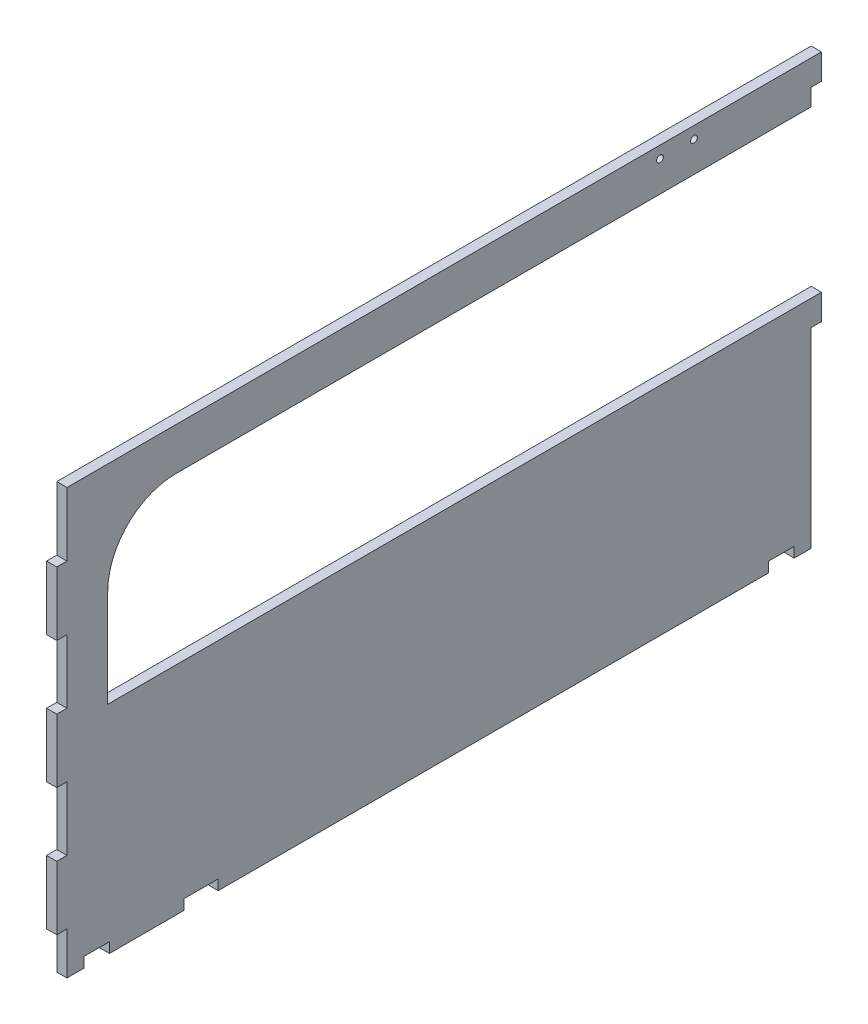
from build123d import *

# Parameters (mm, degrees)
BOSS_EXTRUDE1_DEPTH = 6
SKETCH2_W           = 6
SKETCH2_H           = 37.5
CUT_EXTRUDE1_DEPTH  = 6
LPATTERN1_COUNT     = 4
LPATTERN1_PITCH     = 75
FILLET1_R           = 40
SKETCH3_W           = 6
SKETCH3_H           = 10
SKETCH3_H_2         = 112.5
CUT_EXTRUDE2_DEPTH  = 515.816472153
SKETCH4_W           = 15
SKETCH4_H           = 6
CUT_EXTRUDE3_DEPTH  = 515.816472153
SKETCH5_R           = 2
CUT_EXTRUDE4_DEPTH  = 515.816472153
SKETCH6_W           = 20
SKETCH6_H           = 6
CUT_EXTRUDE5_DEPTH  = 515.816472153


with BuildPart() as part:
    # Sketch1 → Boss-Extrude1 (new body)
    with BuildSketch(Plane(origin=(0, 0, 0), x_dir=(0, 0, -1), z_dir=(1, 0, 0))):
        Polygon((450, 225), (450, 250), (0, 250), (0, 0), (450, 0), (450, 127.5), (30, 127.5), (30, 225), align=None)
    extrude(amount=BOSS_EXTRUDE1_DEPTH)

    # Sketch2 → Cut-Extrude1 (cut)
    with BuildSketch(Plane(origin=(6, 0, 0), x_dir=(0, 0, -1), z_dir=(1, 0, 0))):
        with Locations((3, 231.25)):
            Rectangle(SKETCH2_W, SKETCH2_H)
    cut_extrude1 = extrude(amount=-CUT_EXTRUDE1_DEPTH, mode=Mode.SUBTRACT)

    # LPattern1: Cut-Extrude1 ×4
    with Locations(*[(0, -i * LPATTERN1_PITCH, 0) for i in range(1, LPATTERN1_COUNT)]):
        add(cut_extrude1, mode=Mode.SUBTRACT)

    # Fillet1
    fillet1_edges = [part.edges().sort_by_distance(p)[0] for p in [
        (3, 225, -30),
    ]]
    fillet(fillet1_edges, radius=FILLET1_R)

    # Sketch3 → Cut-Extrude2 (cut, through all)
    with BuildSketch(Plane.ZY):
        with Locations((-447, 230)):
            Rectangle(SKETCH3_W, SKETCH3_H)
        with Locations((-447, 56.25)):
            Rectangle(SKETCH3_W, SKETCH3_H_2)
    extrude(amount=-CUT_EXTRUDE2_DEPTH, mode=Mode.SUBTRACT)

    # Sketch4 → Cut-Extrude3 (cut, through all)
    with BuildSketch(Plane.ZY):
        with Locations((-23.5, 3)):
            Rectangle(SKETCH4_W, SKETCH4_H)
        with Locations((-426.5, 3)):
            Rectangle(SKETCH4_W, SKETCH4_H)
    extrude(amount=-CUT_EXTRUDE3_DEPTH, mode=Mode.SUBTRACT)

    # Sketch5 → Cut-Extrude4 (cut, through all)
    with BuildSketch(Plane.ZY):
        with Locations((-375, 243)):
            Circle(SKETCH5_R)
        with Locations((-355, 243)):
            Circle(SKETCH5_R)
    extrude(amount=-CUT_EXTRUDE4_DEPTH, mode=Mode.SUBTRACT)

    # Sketch6 → Cut-Extrude5 (cut, through all)
    with BuildSketch(Plane.ZY):
        with Locations((-85, 3)):
            Rectangle(SKETCH6_W, SKETCH6_H)
    extrude(amount=-CUT_EXTRUDE5_DEPTH, mode=Mode.SUBTRACT)


solid = part.part
